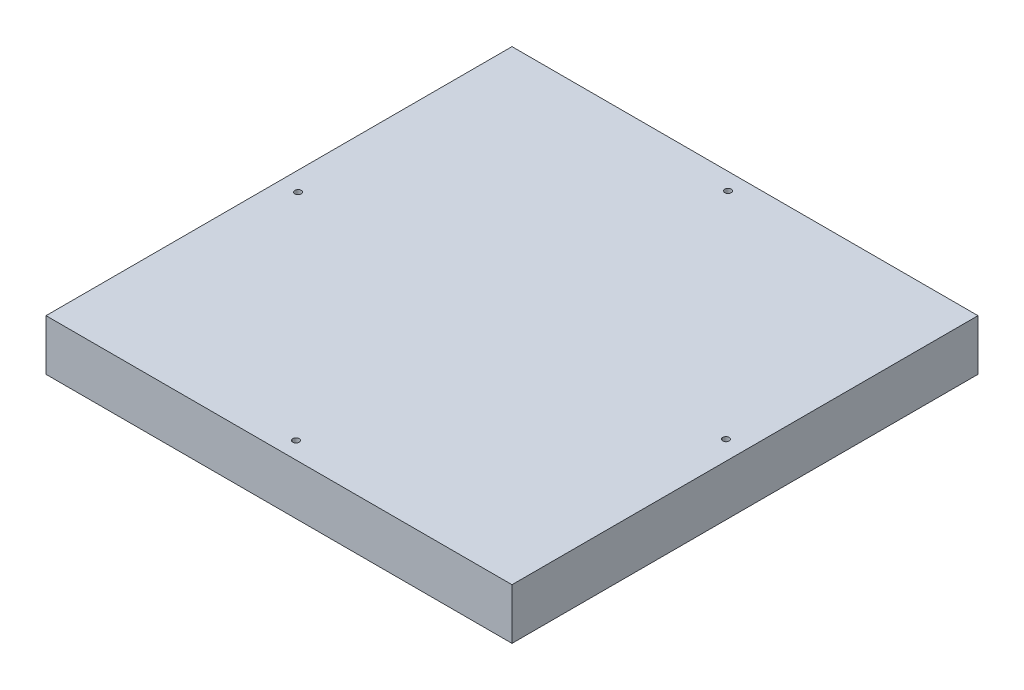
from build123d import *

# Parameters (mm, degrees)
SKETCH1_W           = 220
SKETCH1_H           = 220
SKETCH1_R           = 1.5
BOSS_EXTRUDE1_DEPTH = 24


with BuildPart() as part:
    # Sketch1 → Boss-Extrude1 (new body)
    with BuildSketch(Plane(origin=(0, 0, 0), x_dir=(1, 0, 0), z_dir=(0, 1, 0))):
        Rectangle(SKETCH1_W, SKETCH1_H)
        with Locations((-101, 0)):
            Circle(SKETCH1_R, mode=Mode.SUBTRACT)
        with Locations((101, 0)):
            Circle(SKETCH1_R, mode=Mode.SUBTRACT)
        with Locations((0, -102)):
            Circle(SKETCH1_R, mode=Mode.SUBTRACT)
        with Locations((0, 102)):
            Circle(SKETCH1_R, mode=Mode.SUBTRACT)
    extrude(amount=BOSS_EXTRUDE1_DEPTH)


solid = part.part
